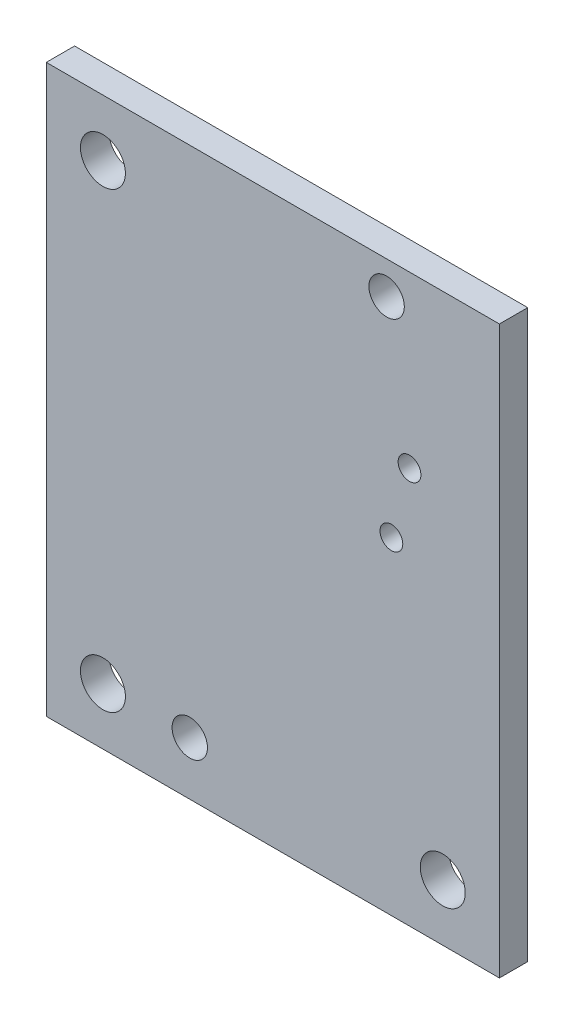
from build123d import *

# Parameters (mm, degrees)
SKETCH2_W                       = 127
SKETCH2_H                       = 101.6
BOSS_EXTRUDE1_DEPTH             = 6.35
F_3_8_CLEARANCE_HOLE1_D         = 10.0838
TAP_DRILL_FOR_1_4_20_TAP1_D     = 5.1054
TAP_DRILL_FOR_3_8_16_TAP2_D     = 7.9375
TAP_DRILL_FOR_3_8_16_TAP2_DEPTH = 12.7
TAP_DRILL_FOR_3_8_16_TAP2_TIP   = 2.384665582


with BuildPart() as part:
    # Sketch2 → Boss-Extrude1 (new body)
    with BuildSketch(Plane(origin=(0, 0, 0), x_dir=(0, 1, 0), z_dir=(0, 0, 1))):
        with Locations((63.5, 50.8)):
            Rectangle(SKETCH2_W, SKETCH2_H)
    extrude(amount=BOSS_EXTRUDE1_DEPTH)

    # 3/8 Clearance Hole1 (through all)
    with Locations(Plane.XY.offset(6.35)):
        with Locations((-12.7, 12.7), (-88.9, 12.7), (-88.9, 114.3)):
            Hole(F_3_8_CLEARANCE_HOLE1_D / 2)

    # Tap Drill for 1/4-20 Tap1 (through all)
    with Locations(Plane.XY.offset(6.35)):
        with Locations((-24.21763, 73.435972), (-20.155408, 88.9)):
            Hole(TAP_DRILL_FOR_1_4_20_TAP1_D / 2)

    # Tap Drill for 3/8-16 Tap2
    with Locations(Plane.XY.offset(6.35)):
        with Locations((-69.426136315, 11.96743958), (-25.287966745, 119.686032541)):
            Hole(TAP_DRILL_FOR_3_8_16_TAP2_D / 2, depth=TAP_DRILL_FOR_3_8_16_TAP2_DEPTH)
            with Locations((0, 0, -(TAP_DRILL_FOR_3_8_16_TAP2_DEPTH + TAP_DRILL_FOR_3_8_16_TAP2_TIP / 2))):  # 118° drill point
                Cone(0, TAP_DRILL_FOR_3_8_16_TAP2_D / 2, TAP_DRILL_FOR_3_8_16_TAP2_TIP, mode=Mode.SUBTRACT)


solid = part.part
